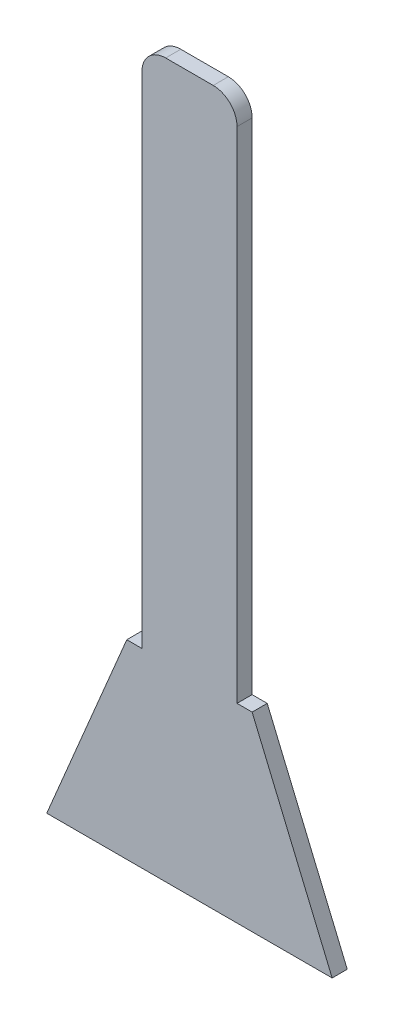
from build123d import *

# Parameters (mm, degrees)
BOSS_EXTRU_1_DEPTH = 6.35
CONG_1_R           = 10


with BuildPart() as part:
    # Esquisse1 → Boss.-Extru.1 (new body)
    with BuildSketch(Plane.XY):
        Polygon((-20, 300), (20, 300), (20, 80), (26.35, 80), (60, 0), (-60, 0), (-26.35, 80), (-20, 80), align=None)
    extrude(amount=BOSS_EXTRU_1_DEPTH)

    # Congé1
    cong_1_edges = [part.edges().sort_by_distance(p)[0] for p in [
        (20, 300, 3.175),
        (-20, 300, 3.175),
    ]]
    fillet(cong_1_edges, radius=CONG_1_R)


solid = part.part
